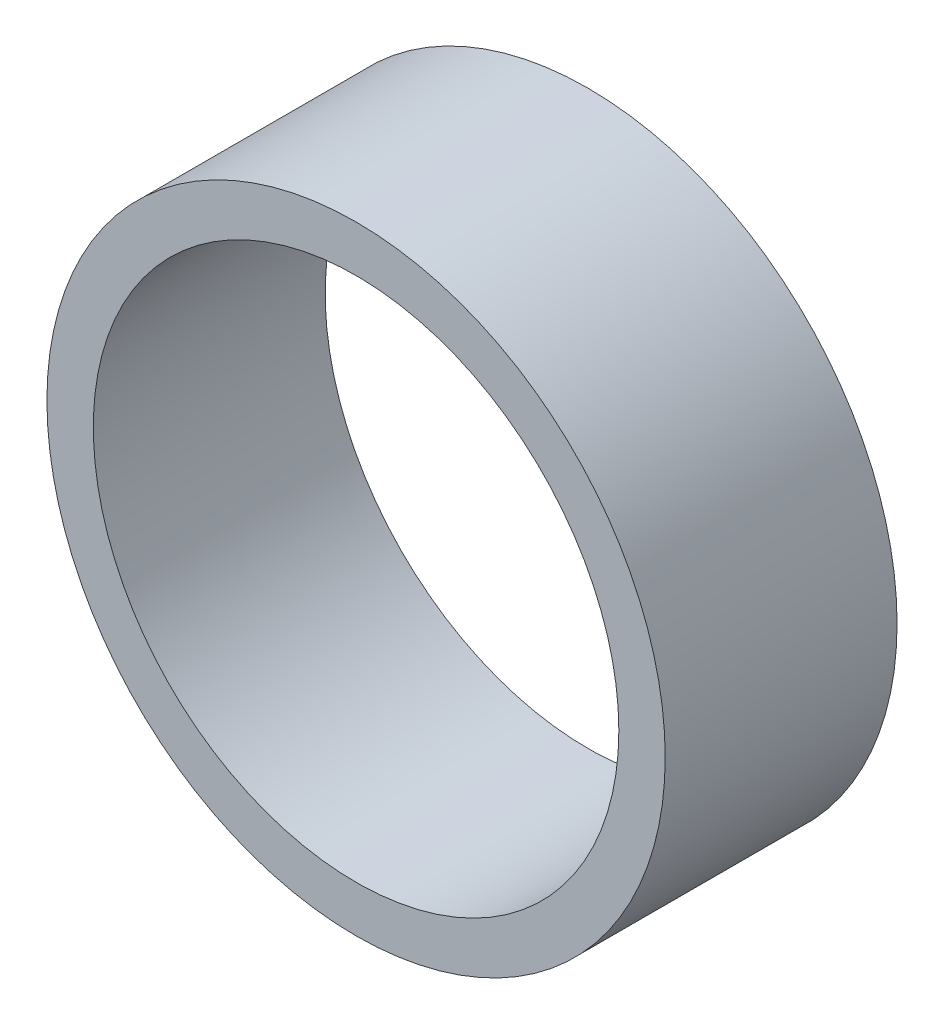
from build123d import *

# Parameters (mm, degrees)
SKETCH1_R           = 6
SKETCH1_R_2         = 5.1
BOSS_EXTRUDE1_DEPTH = 4.5


with BuildPart() as part:
    # Sketch1 → Boss-Extrude1 (new body)
    with BuildSketch(Plane.XY):
        Circle(SKETCH1_R)
        Circle(SKETCH1_R_2, mode=Mode.SUBTRACT)
    extrude(amount=BOSS_EXTRUDE1_DEPTH)


solid = part.part
